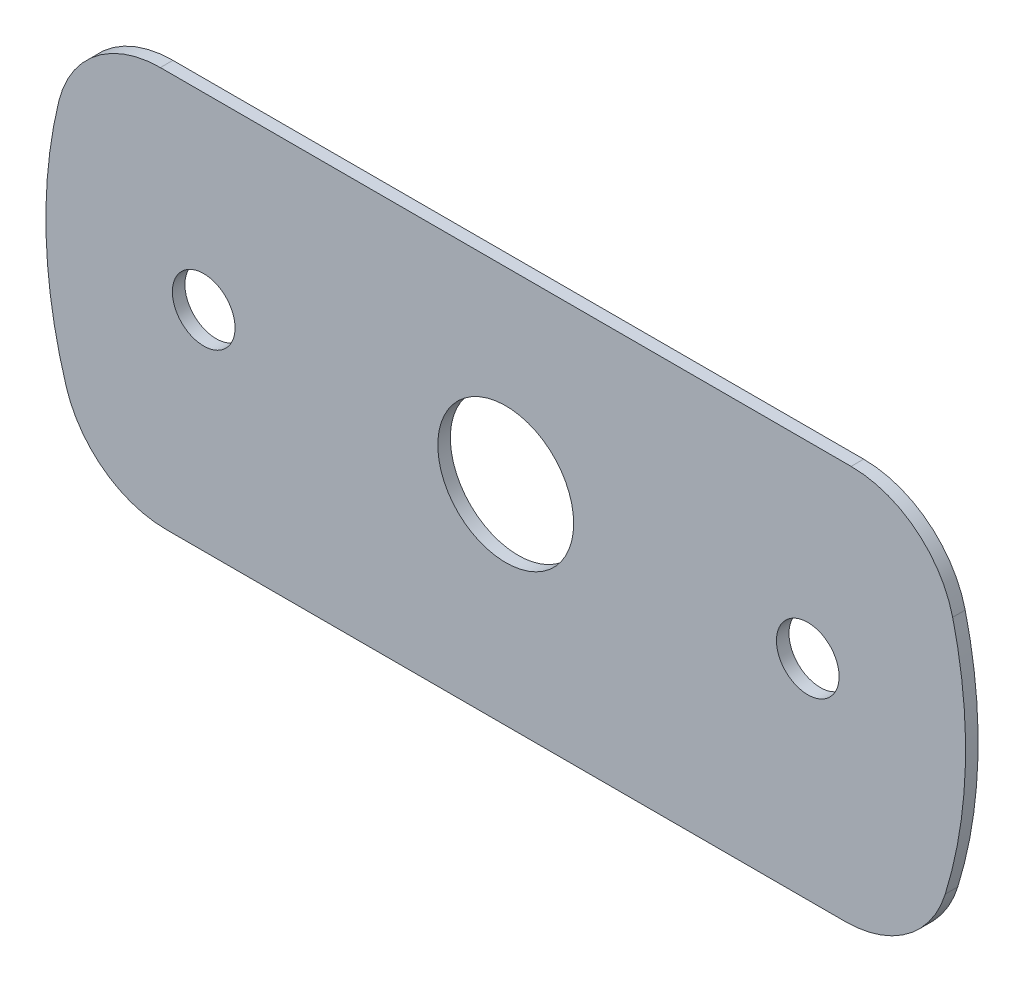
from build123d import *

# Parameters (mm, degrees)
SKETCH_1_R          = 22
EXTRUDE_1_DEPTH     = 0.6
SKETCH_2_R          = 3.25
CUT_EXTRUDE_1_DEPTH = 32.118483254
SKETCH_3_R          = 1.5
CUT_EXTRUDE_2_DEPTH = 32.118483254
SKETCH_5_W          = 56.096765119
SKETCH_5_H          = 19.515049226
SKETCH_5_W_2        = 56.672855133
SKETCH_5_H_2        = 21.675386779
CUT_EXTRUDE_4_DEPTH = 32.118483254
FILLET_1_R          = 5


with BuildPart() as part:
    # Эскиз1 → Бобышка-Вытянуть1 (new body)
    with BuildSketch(Plane.XY):
        Circle(SKETCH_1_R)
    extrude(amount=EXTRUDE_1_DEPTH)

    # Эскиз2 → Вырез-Вытянуть1 (cut, through all)
    with BuildSketch(Plane.XY.offset(0.6)):
        Circle(SKETCH_2_R)
    extrude(amount=-CUT_EXTRUDE_1_DEPTH, mode=Mode.SUBTRACT)

    # Эскиз3 → Вырез-Вытянуть2 (cut, through all)
    with BuildSketch(Plane.XY.offset(0.6)):
        with Locations((-14.45, 0)):
            Circle(SKETCH_3_R)
        with Locations((14.45, 0)):
            Circle(SKETCH_3_R)
    extrude(amount=-CUT_EXTRUDE_2_DEPTH, mode=Mode.SUBTRACT)

    # Эскиз5 → Вырез-Вытянуть4 (cut, through all)
    with BuildSketch(Plane.XY.offset(0.6)):
        with Locations((0.108016877, 18.757524613)):
            Rectangle(SKETCH_5_W, SKETCH_5_H)
        with Locations((0.396061884, -20.83769339)):
            Rectangle(SKETCH_5_W_2, SKETCH_5_H_2)
    extrude(amount=-CUT_EXTRUDE_4_DEPTH, mode=Mode.SUBTRACT)

    # Скругление1
    fillet_1_edges = [part.edges().sort_by_distance(p)[0] for p in [
        (20.0748599, 9, 0.3),
        (19.595917942, -10, 0.3),
        (-19.595917942, -10, 0.3),
        (-20.0748599, 9, 0.3),
    ]]
    fillet(fillet_1_edges, radius=FILLET_1_R)


solid = part.part
